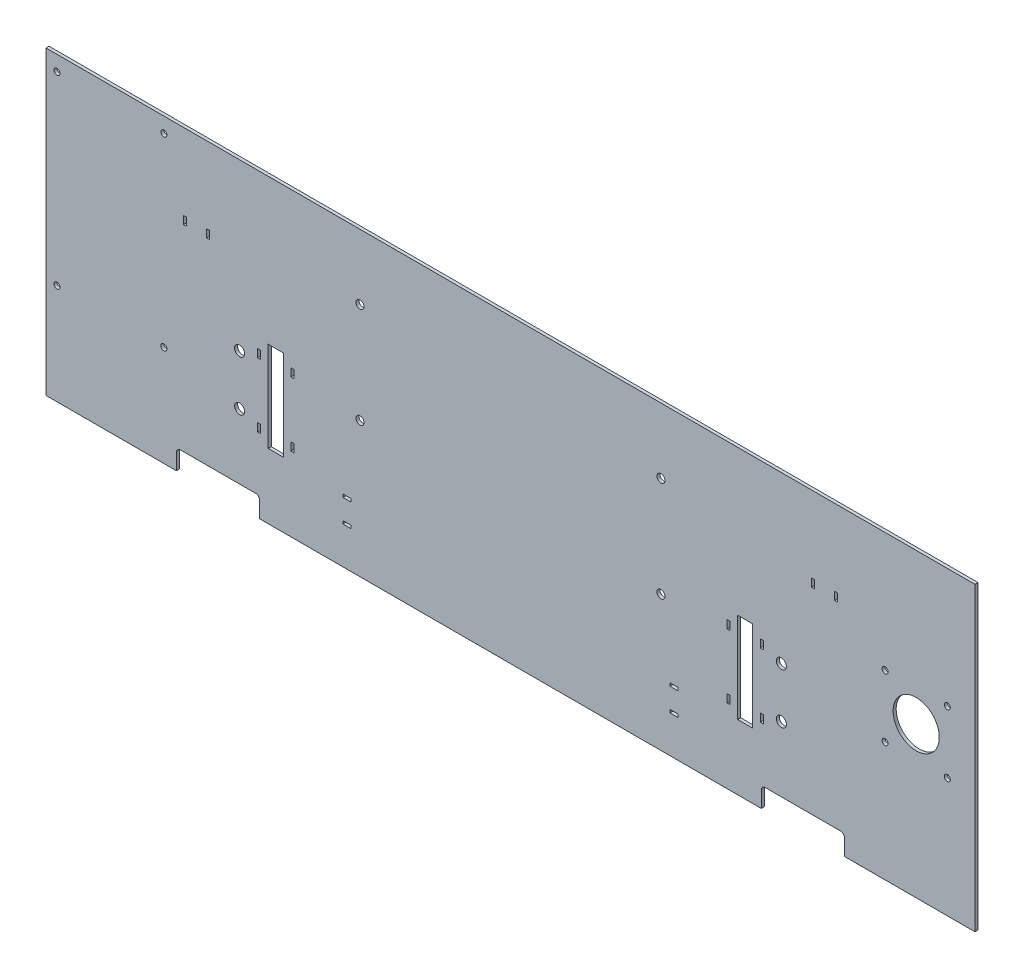
from build123d import *

# Parameters (mm, degrees)
SKETCH1_W          = 463
SKETCH1_H          = 150
BASE_FLANGE1_DEPTH = 1.51892
SKETCH48_R         = 1.5
SKETCH48_R_2       = 11.5
SKETCH48_R_3       = 2.5
SKETCH48_R_4       = 2
SKETCH48_W         = 7.5
SKETCH48_H         = 45
SKETCH48_W_2       = 1.5
SKETCH48_H_2       = 4
SKETCH48_W_3       = 4
SKETCH48_H_3       = 1.5
CUT_EXTRUDE1_DEPTH = 1.51892
CUT_EXTRUDE3_DEPTH = 10


# Sheet-metal steps are written as plain solids
with BuildPart() as part:
    # Sketch1 → Base-Flange1 (new body)
    with BuildSketch(Plane.XY):
        Rectangle(SKETCH1_W, SKETCH1_H)
    extrude(amount=-BASE_FLANGE1_DEPTH)

    # Sketch48 → Cut-Extrude1 (cut)
    with BuildSketch(Plane(origin=(0, 0, -1.51892), x_dir=(-1, 0, 0), z_dir=(0, 0, -1))):
        with Locations((-186.715, -15.5)):
            Circle(SKETCH48_R)
        with Locations((-186.715, 15.5)):
            Circle(SKETCH48_R)
        with Locations((-217.715, 15.5)):
            Circle(SKETCH48_R)
        with Locations((-202.215, 0)):
            Circle(SKETCH48_R_2)
        with Locations((-217.715, -15.5)):
            Circle(SKETCH48_R)
        with Locations((-135, -7.5)):
            Circle(SKETCH48_R_3)
        with Locations((-135, -32.5)):
            Circle(SKETCH48_R_3)
        with Locations((-75, -7.5)):
            Circle(SKETCH48_R_4)
        with Locations((-75, 42.5)):
            Circle(SKETCH48_R_4)
        with Locations((135, -32.5)):
            Circle(SKETCH48_R_3)
        with Locations((135, -7.5)):
            Circle(SKETCH48_R_3)
        with Locations((75, -7.5)):
            Circle(SKETCH48_R_4)
        with Locations((75, 42.5)):
            Circle(SKETCH48_R_4)
        with Locations((172.74192, -24.83591994)):
            Circle(SKETCH48_R)
        with Locations((226.01892, -24.83591994)):
            Circle(SKETCH48_R)
        with Locations((172.74192, 67.48108)):
            Circle(SKETCH48_R)
        with Locations((226.01892, 67.48108)):
            Circle(SKETCH48_R)
        with Locations((117, -20)):
            Rectangle(SKETCH48_W, SKETCH48_H)
        with Locations((-117, -20)):
            Rectangle(SKETCH48_W, SKETCH48_H)
        with Locations((-108.75, -4)):
            Rectangle(SKETCH48_W_2, SKETCH48_H_2)
        with Locations((-125.25, -4)):
            Rectangle(SKETCH48_W_2, SKETCH48_H_2)
        with Locations((-125.25, -36)):
            Rectangle(SKETCH48_W_2, SKETCH48_H_2)
        with Locations((-108.75, -36)):
            Rectangle(SKETCH48_W_2, SKETCH48_H_2)
        with Locations((-81.5, -44.25)):
            Rectangle(SKETCH48_W_3, SKETCH48_H_3)
        with Locations((-81.5, -55.75)):
            Rectangle(SKETCH48_W_3, SKETCH48_H_3)
        with Locations((-150.75, 35)):
            Rectangle(SKETCH48_W_2, SKETCH48_H_2)
        with Locations((-162.25, 35)):
            Rectangle(SKETCH48_W_2, SKETCH48_H_2)
        with Locations((125.25, -36)):
            Rectangle(SKETCH48_W_2, SKETCH48_H_2)
        with Locations((108.75, -36)):
            Rectangle(SKETCH48_W_2, SKETCH48_H_2)
        with Locations((81.5, -44.25)):
            Rectangle(SKETCH48_W_3, SKETCH48_H_3)
        with Locations((81.5, -55.75)):
            Rectangle(SKETCH48_W_3, SKETCH48_H_3)
        with Locations((162.25, 35)):
            Rectangle(SKETCH48_W_2, SKETCH48_H_2)
        with Locations((150.75, 35)):
            Rectangle(SKETCH48_W_2, SKETCH48_H_2)
        with Locations((108.75, -4)):
            Rectangle(SKETCH48_W_2, SKETCH48_H_2)
        with Locations((125.25, -4)):
            Rectangle(SKETCH48_W_2, SKETCH48_H_2)
    extrude(amount=-CUT_EXTRUDE1_DEPTH, mode=Mode.SUBTRACT)

    # Sketch50 → Cut-Extrude3 (cut)
    with BuildSketch(Plane.XY):
        with BuildLine():
            Line((166.5, -67), (166.5, -75))
            Line((166.5, -75), (125, -75))
            Line((125, -75), (125, -67))
            ThreePointArc((125, -67), (125.585786438, -65.585786438), (127, -65))
            Line((127, -65), (164.5, -65))
            ThreePointArc((164.5, -65), (165.914213562, -65.585786438), (166.5, -67))
        make_face()
        with BuildLine():
            Line((-125, -67), (-125, -75))
            Line((-125, -75), (-166.5, -75))
            Line((-166.5, -75), (-166.5, -67))
            ThreePointArc((-166.5, -67), (-165.914213562, -65.585786438), (-164.5, -65))
            Line((-164.5, -65), (-127, -65))
            ThreePointArc((-127, -65), (-125.585786438, -65.585786438), (-125, -67))
        make_face()
    extrude(amount=-CUT_EXTRUDE3_DEPTH, mode=Mode.SUBTRACT)


solid = part.part
